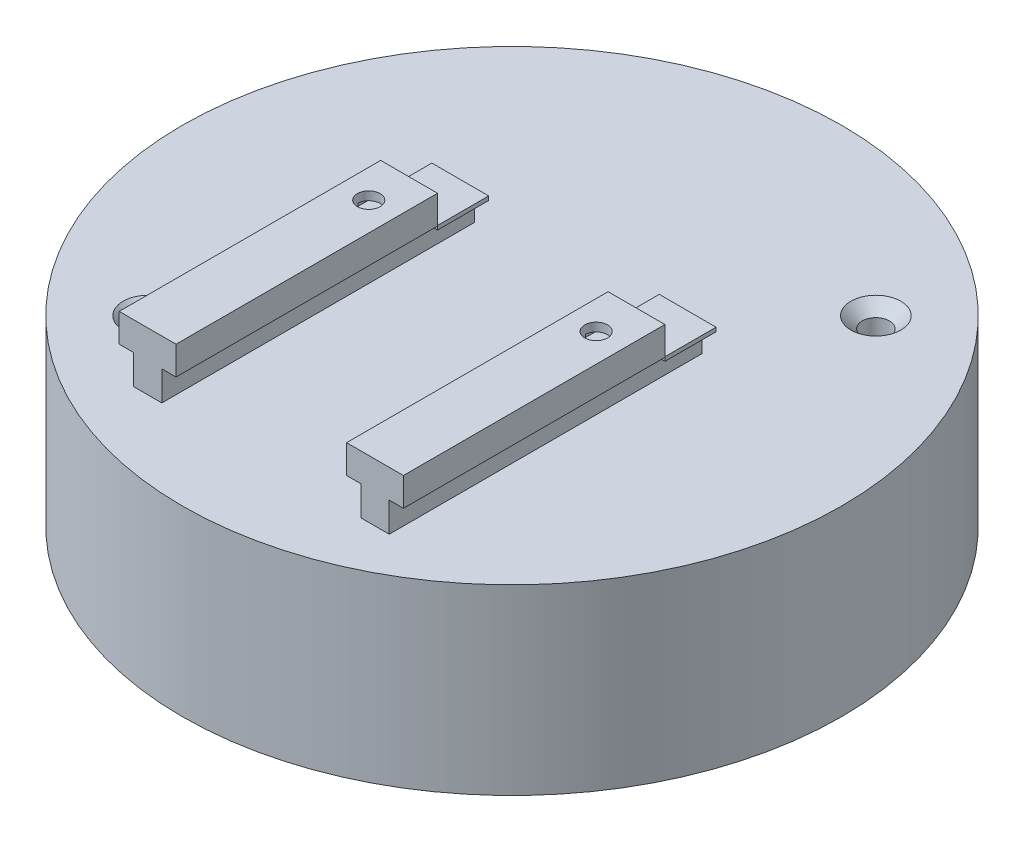
from build123d import *

# Parameters (mm, degrees)
BOSS_EXTRUDE1_DEPTH                                  = 22.05
BOSS_EXTRUDE1_DEPTH_BACK                             = 5.45
BOSS_EXTRUDE1_2_DEPTH                                = 22.05
BOSS_EXTRUDE1_2_DEPTH_BACK                           = 5.45
SKETCH3_W                                            = 51.63175717
SKETCH3_H                                            = 2.803707317
CUT_EXTRUDE1_DEPTH                                   = 4.5
SKETCH5_W                                            = 5
SKETCH5_H                                            = 4.5
BOSS_EXTRUDE2_DEPTH                                  = 0.35
SKETCH4_W                                            = 3.5
SKETCH4_H                                            = 1
CUT_EXTRUDE2_DEPTH                                   = 3.5
BOSS_EXTRUDE3_DEPTH                                  = 16.05
SHELL3_START                                         = -16.05
SHELL3_OUTLINE_R                                     = 26.3
SHELL3_DEPTH                                         = 13.35
F_2_0_2_DIAMETER_HOLE1_D                             = 2
CSK_SLOT_FOR_M2_COUNTERSUNK_FLAT_HEAD_SC_D           = 2.4
CSK_SLOT_FOR_M2_COUNTERSUNK_FLAT_HEAD_SC_CSINK_D     = 4.4
CSK_SLOT_FOR_M2_COUNTERSUNK_FLAT_HEAD_SC_CSINK_ANGLE = 90


# Read off the part's stored shape, not the designer's step: Shell3
with BuildPart() as part:
    # Sketch2 → Boss-Extrude1 (new, two sides: drawn at the far end of the back side and taken through both)
    with BuildSketch(Plane.XY.offset(-BOSS_EXTRUDE1_DEPTH_BACK)):
        Polygon((-11.25, 0), (-11.25, 2.6), (-12.5, 2.6), (-12.5, 5.1), (-7.5, 5.1), (-7.5, 2.6), (-8.75, 2.6), (-8.75, 0), align=None)
    extrude(amount=BOSS_EXTRUDE1_DEPTH + BOSS_EXTRUDE1_DEPTH_BACK)


with BuildPart() as body_2:
    # Sketch2 → Boss-Extrude1 2 (new, two sides: drawn at the far end of the back side and taken through both)
    with BuildSketch(Plane.XY.offset(-BOSS_EXTRUDE1_2_DEPTH_BACK)):
        Polygon((8.75, 0), (11.25, 0), (11.25, 2.6), (12.5, 2.6), (12.5, 5.1), (7.5, 5.1), (7.5, 2.6), (8.75, 2.6), align=None)
    extrude(amount=BOSS_EXTRUDE1_2_DEPTH + BOSS_EXTRUDE1_2_DEPTH_BACK)


with BuildPart() as cut_extrude1_tool:
    # Sketch3 → Cut-Extrude1 (new body)
    with BuildSketch(Plane(origin=(0, 0, -5.45), x_dir=(-1, 0, 0), z_dir=(0, 0, -1))):
        with Locations((1.197864232, 3.698146342)):
            Rectangle(SKETCH3_W, SKETCH3_H)
    extrude(amount=-CUT_EXTRUDE1_DEPTH)


with BuildPart() as part_1:
    add(part.part)

    # Cut-Extrude1: cut by cut_extrude1_tool
    add(cut_extrude1_tool.part, mode=Mode.SUBTRACT)



with BuildPart() as body_2_1:
    add(body_2.part)

    # Cut-Extrude1: cut by cut_extrude1_tool
    add(cut_extrude1_tool.part, mode=Mode.SUBTRACT)


with BuildPart() as part_2:
    add(part_1.part)

    add(body_2_1.part)  # Boss-Extrude2 merges body 2
    # Sketch5 → Boss-Extrude2 (add)
    with BuildSketch(Plane(origin=(0, 2.296292683, 0), x_dir=(1, 0, 0), z_dir=(0, 1, 0))):
        with Locations((10, 3.2)):
            Rectangle(SKETCH5_W, SKETCH5_H)
        with Locations((-10, 3.2)):
            Rectangle(SKETCH5_W, SKETCH5_H)
    extrude(amount=BOSS_EXTRUDE2_DEPTH)

    # Sketch4 → Cut-Extrude2 (cut)
    with BuildSketch(Plane(origin=(0, 0, -0.95), x_dir=(-1, 0, 0), z_dir=(0, 0, -1))):
        with Locations((10, 3.85)):
            Rectangle(SKETCH4_W, SKETCH4_H)
        with Locations((-10, 3.85)):
            Rectangle(SKETCH4_W, SKETCH4_H)
    extrude(amount=-CUT_EXTRUDE2_DEPTH, mode=Mode.SUBTRACT)

    # Sketch1 → Boss-Extrude3 (add)
    with BuildSketch(Plane(origin=(0, 0, 0), x_dir=(1, 0, 0), z_dir=(0, 1, 0))):
        with BuildLine():
            ThreePointArc((-29, -7.4e-08), (-26.336723438, -12.139892855), (-18.836069123, -22.05))
            Line((-18.836069123, -22.05), (18.836069123, -22.05))
            ThreePointArc((18.836069123, -22.05), (26.336723454, -12.139892822), (29, 0))
            ThreePointArc((29, 0), (-3.7e-08, 29), (-29, -7.4e-08))
        make_face()
        with BuildLine():
            Line((18.836069123, -22.05), (-18.836069123, -22.05))
            ThreePointArc((-18.836069123, -22.05), (0, -29), (18.836069123, -22.05))
        make_face()
    extrude(amount=-BOSS_EXTRUDE3_DEPTH)

    # Shell3 outline → Shell3 (cut)
    with BuildSketch(Plane(origin=(0, 0, 0), x_dir=(1, 0, 0), z_dir=(0, 1, 0)).offset(SHELL3_START)):
        Circle(SHELL3_OUTLINE_R)
    extrude(amount=SHELL3_DEPTH, mode=Mode.SUBTRACT)

    # Ø2.0 (2) Diameter Hole1 (through all)
    with Locations(Plane(origin=(0, 5.1, 0), x_dir=(1, 0, 0), z_dir=(0, 1, 0))):
        with Locations((10, -2.6), (-10, -2.6)):
            Hole(F_2_0_2_DIAMETER_HOLE1_D / 2)

    # CSK SLOT for M2 Countersunk Flat Head Screw3 (through all)
    with Locations(Plane(origin=(0, 0, 0), x_dir=(1, 0, 0), z_dir=(0, 1, 0))):
        with Locations((-16.001826458, -16.001826458), (16.001826458, 16.001826458)):
            CounterSinkHole(CSK_SLOT_FOR_M2_COUNTERSUNK_FLAT_HEAD_SC_D / 2, CSK_SLOT_FOR_M2_COUNTERSUNK_FLAT_HEAD_SC_CSINK_D / 2, counter_sink_angle=CSK_SLOT_FOR_M2_COUNTERSUNK_FLAT_HEAD_SC_CSINK_ANGLE)


solid = part_2.part
